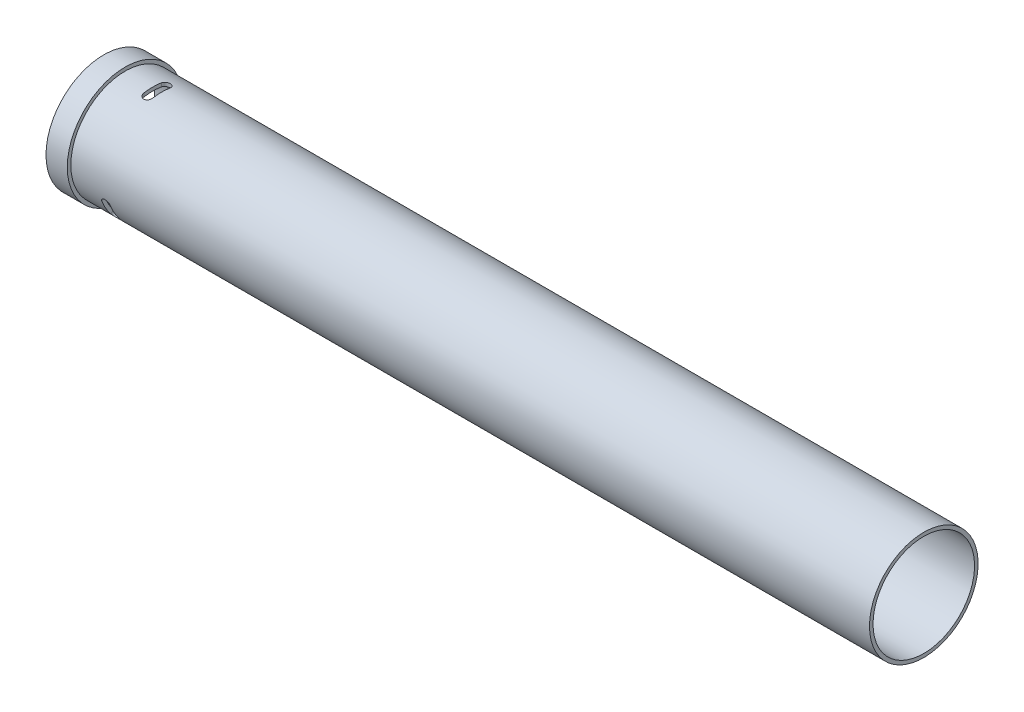
from build123d import *

# Parameters (mm, degrees)
CUT_EXTRUDE1_DEPTH = 5.08
CIRPATTERN1_COUNT  = 3


# Read off the part's stored shape, not the designer's step: Revolve1
with BuildPart() as part:
    # Revolve1 outline → Revolve1 (revolve)
    with BuildSketch(Plane.YX):
        Polygon((20.701, 7.62), (19.430746, 7.62), (19.430746, 293.37), (18.160746, 293.37), (18.160746, 5.08), (18.161, 5.08), (18.161, 0), (20.701, 0), align=None)
    revolve(axis=Axis((0, 0, 0), (1, 0, 0)))

    # Sketch2 → Cut-Extrude1 (cut)
    with BuildSketch(Plane(origin=(0, 19.430746, 0), x_dir=(1, 0, 0), z_dir=(0, 1, 0))):
        with BuildLine():
            Line((20.6375, 3.175), (20.6375, -3.175))
            ThreePointArc((20.6375, -3.175), (19.05, -4.7625), (17.4625, -3.175))
            Line((17.4625, -3.175), (17.4625, 3.175))
            ThreePointArc((17.4625, 3.175), (19.05, 4.7625), (20.6375, 3.175))
        make_face()
    cut_extrude1 = extrude(amount=-CUT_EXTRUDE1_DEPTH, mode=Mode.SUBTRACT)

    # CirPattern1: Cut-Extrude1 ×3 about axis
    cirpattern1_axis = Axis((0, 0, 0), (-1, 0, 0))
    for i in range(1, CIRPATTERN1_COUNT):
        add(cut_extrude1.rotate(cirpattern1_axis, i * 360 / CIRPATTERN1_COUNT), mode=Mode.SUBTRACT)


solid = part.part
